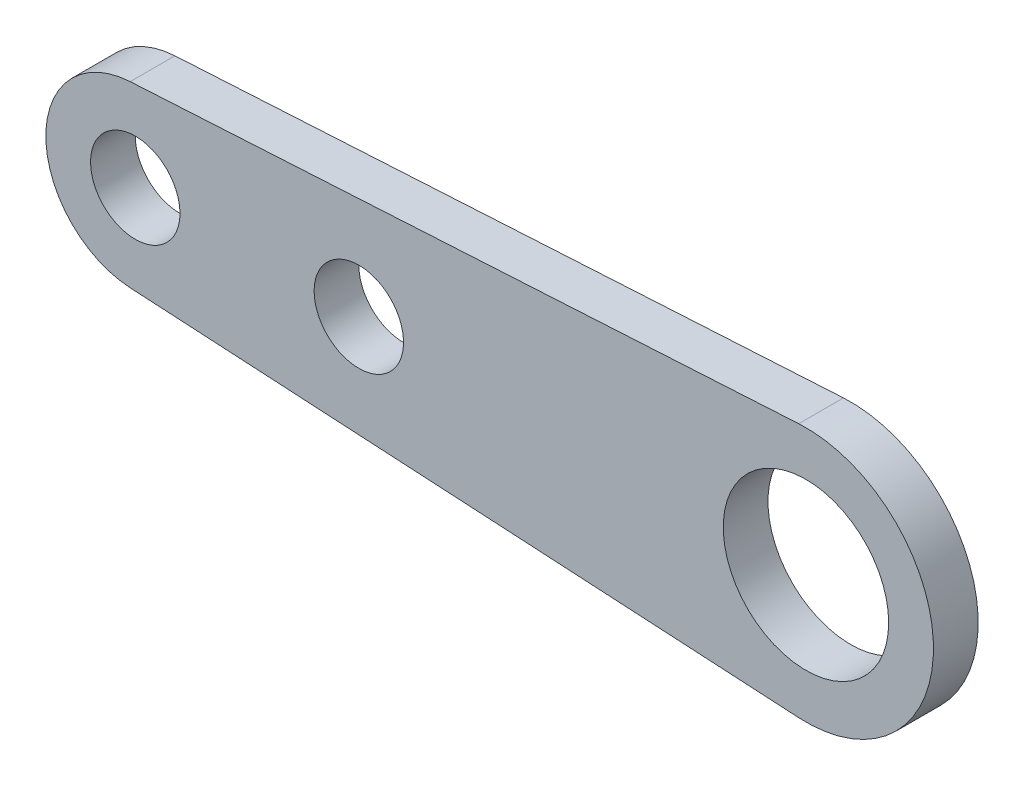
from build123d import *
from build123d.topology import SkipClean

# Parameters (mm, degrees)
BOSS_EXTRUDE1_DEPTH = 10


with BuildPart() as part:
    # Sketch1 → Boss-Extrude1 (new body)
    with BuildSketch(Plane(origin=(0, 0, 0), x_dir=(-1, 0, 0), z_dir=(0, 0, 1))):
        with BuildLine():
            Line((0, 0), (10.014962741, 0))
            ThreePointArc((10.014962741, 0), (28.514962741, 18.5), (47.014962741, 0))
            Line((47.014962741, 0), (118.514962741, 0))
            ThreePointArc((118.514962741, 0), (128.514962741, 10), (138.514962741, 0))
            Line((138.514962741, 0), (168.514962741, 0))
            ThreePointArc((168.514962741, 0), (178.514962741, 10), (188.514962741, 0))
            Line((188.514962741, 0), (198.514962741, 0))
            ThreePointArc((198.514962741, 0), (193.052957226, 13.734872273), (179.650291107, 19.967749736))
            Line((179.650291107, 19.967749736), (30.133655043, 28.468981987))
            ThreePointArc((30.133655043, 28.468981987), (8.932494186, 20.727518554), (0, 0))
        make_face()
    boss_extrude1 = extrude(amount=BOSS_EXTRUDE1_DEPTH)

    # Mirror1: Boss-Extrude1 across plane
    with SkipClean():  # the faces are left unmerged after this step: merging them gives an invalid solid
        add(boss_extrude1.mirror(Plane(origin=(-47.014962741, 0, 10), x_dir=(0, 0, 1), z_dir=(0, -1, 0))))


solid = part.part
